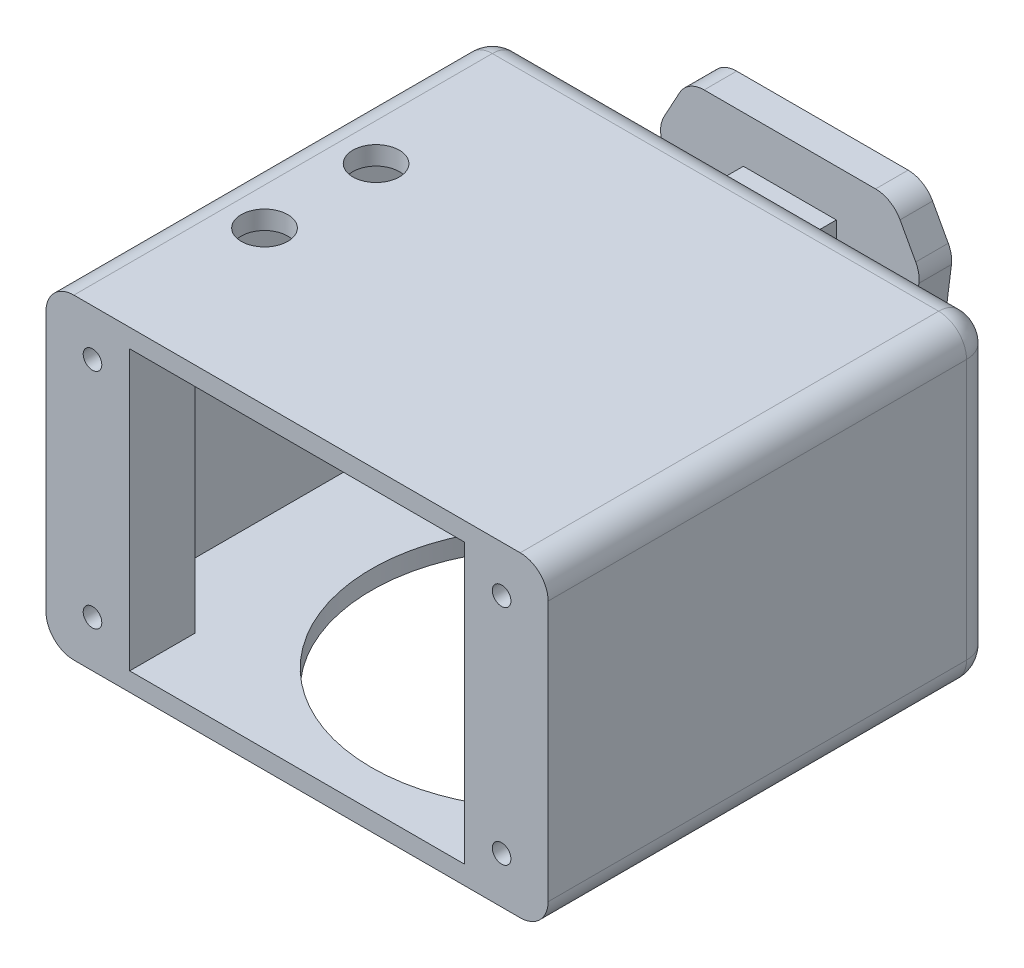
from build123d import *

# Parameters (mm, degrees)
BOSS_EXTRUDE1_DEPTH  = 3.5
SKETCH2_W            = 10
SKETCH2_H            = 3
BOSS_EXTRUDE2_DEPTH  = 5
SKETCH3_W            = 50
SKETCH3_H            = 24
BOSS_EXTRUDE3_DEPTH  = 3
SKETCH4_W            = 50
SKETCH4_H            = 3
BOSS_EXTRUDE4_DEPTH  = 35
SKETCH5_W            = 4
SKETCH5_H            = 29
CUT_EXTRUDE3_DEPTH   = 35
FILLET1_R            = 2
SKETCH6_R            = 3.175
BOSS_EXTRUDE6_DEPTH  = 35
FILLET2_R            = 3
SKETCH8_W            = 10
SKETCH8_H            = 5
BOSS_EXTRUDE7_DEPTH  = 10
SKETCH9_W            = 10
SKETCH9_H            = 5
BOSS_EXTRUDE8_DEPTH  = 10
SKETCH10_W           = 53.514300768
SKETCH10_H           = 42.489179877
CUT_EXTRUDE4_DEPTH   = 20
BOSS_EXTRUDE9_DEPTH  = 40
SKETCH13_W           = 40
SKETCH13_H           = 10
BOSS_EXTRUDE10_DEPTH = 20
SKETCH14_W           = 4
SKETCH14_H           = 20
CUT_EXTRUDE7_DEPTH   = 20
FILLET3_R            = 2
SKETCH16_W           = 40
SKETCH16_H           = 10
CUT_EXTRUDE9_DEPTH   = 4
SKETCH19_W           = 40
SKETCH19_H           = 10
CUT_EXTRUDE10_DEPTH  = 24
SKETCH20_W           = 4
SKETCH20_H           = 2
CUT_EXTRUDE11_DEPTH  = 44
FILLET4_R            = 10
SKETCH21_W           = 58
SKETCH21_H           = 24
BOSS_EXTRUDE11_DEPTH = 2
SKETCH22_W           = 54.310686521
SKETCH22_H           = 40
CUT_EXTRUDE14_DEPTH  = 57
SKETCH24_W           = 10
SKETCH24_H           = 5
CUT_EXTRUDE15_DEPTH  = 5
SKETCH25_W           = 52
SKETCH25_H           = 2
BOSS_EXTRUDE12_DEPTH = 45
SKETCH26_W           = 2
SKETCH26_H           = 45
BOSS_EXTRUDE13_DEPTH = 22
SKETCH27_R           = 2.5
CUT_EXTRUDE16_DEPTH  = 45
SKETCH29_W           = 2
SKETCH29_H           = 45
BOSS_EXTRUDE14_DEPTH = 10
SKETCH30_W           = 45
SKETCH30_H           = 2
BOSS_EXTRUDE15_DEPTH = 50
SKETCH31_R           = 18.5
CUT_EXTRUDE17_DEPTH  = 60
SKETCH32_W           = 3
SKETCH32_H           = 34
BOSS_EXTRUDE17_DEPTH = 2
SKETCH33_W           = 2
SKETCH33_H           = 34
BOSS_EXTRUDE18_DEPTH = 45
BOSS_EXTRUDE20_REACH = 76.256
SKETCH37_W           = 7
SKETCH37_H           = 7
SKETCH38_R           = 1
CUT_EXTRUDE18_DEPTH  = 16
FILLET5_R            = 3
FILLET6_R            = 3
SKETCH39_W           = 5
SKETCH39_H           = 5
CUT_EXTRUDE22_DEPTH  = 10
FILLET7_R            = 1
SKETCH40_W           = 7
SKETCH40_H           = 30
BOSS_EXTRUDE21_DEPTH = 0.2


# Some blends are built 0.0001 mm under size
with BuildPart() as part:
    # Sketch1 → Boss-Extrude1 (new body)
    with BuildSketch(Plane.XY):
        Polygon((0, 24), (3, 0), (25, 0), (28, 24), (25, 29.5), (3, 29.5), align=None)
    extrude(amount=-BOSS_EXTRUDE1_DEPTH)

    # Sketch2 → Boss-Extrude2 (add)
    with BuildSketch(Plane.XY):
        with Locations((14, 18)):
            Rectangle(SKETCH2_W, SKETCH2_H)
    extrude(amount=BOSS_EXTRUDE2_DEPTH)

    # Sketch3 → Boss-Extrude3 (add)
    with BuildSketch(Plane.XY.offset(5)):
        with Locations((14, 17.5)):
            Rectangle(SKETCH3_W, SKETCH3_H)
    extrude(amount=BOSS_EXTRUDE3_DEPTH)

    # Sketch4 → Boss-Extrude4 (add)
    with BuildSketch(Plane.XY.offset(8)):
        with Locations((14, 28)):
            Rectangle(SKETCH4_W, SKETCH4_H)
    extrude(amount=BOSS_EXTRUDE4_DEPTH)

    # Sketch5 → Cut-Extrude3 (cut)
    with BuildSketch(Plane(origin=(0, 29.5, 0), x_dir=(1, 0, 0), z_dir=(0, 1, 0))):
        with Locations((-6, -25.5)):
            Rectangle(SKETCH5_W, SKETCH5_H)
    extrude(amount=-CUT_EXTRUDE3_DEPTH, mode=Mode.SUBTRACT)

    # Fillet1
    fillet1_edges = [part.edges().sort_by_distance(p)[0] for p in [
        (-8, 28, 40),
        (-4, 28, 40),
        (-4, 28, 11),
        (-8, 28, 11),
    ]]
    fillet(fillet1_edges, radius=FILLET1_R - 0.0001)  # a hair under: the kernel refuses the full size

    # Sketch6 → Boss-Extrude6 (add)
    with BuildSketch(Plane(origin=(39, 0, 0), x_dir=(0, 0, -1), z_dir=(1, 0, 0))):
        with BuildLine():
            Line((-29.274917218, 38.5), (-43, 29.5))
            Line((-43, 29.5), (-5, 29.5))
            Line((-5, 29.5), (-21.725082782, 38.5))
            ThreePointArc((-21.725082782, 38.5), (-25.5, 40), (-29.274917218, 38.5))
        make_face()
        with Locations((-25.5, 34.5)):
            Circle(SKETCH6_R, mode=Mode.SUBTRACT)
    extrude(amount=-BOSS_EXTRUDE6_DEPTH)

    # Fillet2
    fillet2_edges = [part.edges().sort_by_distance(p)[0] for p in [
        (25, 0, -1.75),
        (3, 0, -1.75),
        (0, 24, -1.75),
        (3, 29.5, -1.75),
        (25, 29.5, -1.75),
        (28, 24, -1.75),
    ]]
    fillet(fillet2_edges, radius=FILLET2_R)

    # Sketch8 → Boss-Extrude7 (add)
    with BuildSketch(Plane(origin=(0, 19.5, 0), x_dir=(1, 0, 0), z_dir=(0, 1, 0))):
        with Locations((14, -2.5)):
            Rectangle(SKETCH8_W, SKETCH8_H)
    extrude(amount=BOSS_EXTRUDE7_DEPTH)

    # Sketch9 → Boss-Extrude8 (add)
    with BuildSketch(Plane.XZ.offset(-16.5)):
        with Locations((14, 2.5)):
            Rectangle(SKETCH9_W, SKETCH9_H)
    extrude(amount=BOSS_EXTRUDE8_DEPTH)

    # Sketch10 → Cut-Extrude4 (cut)
    with BuildSketch(Plane(origin=(0, 29.5, 0), x_dir=(1, 0, 0), z_dir=(0, 1, 0))):
        with Locations((30.757150384, -26.244589939)):
            Rectangle(SKETCH10_W, SKETCH10_H)
    extrude(amount=CUT_EXTRUDE4_DEPTH, mode=Mode.SUBTRACT)

    # Sketch11 → Boss-Extrude9 (add)
    with BuildSketch(Plane(origin=(39, 0, 0), x_dir=(0, 0, -1), z_dir=(1, 0, 0))):
        with BuildLine():
            Line((-43, 39.5), (-43, 29.5))
            Line((-43, 29.5), (-24, 29.5))
            Line((-24, 29.5), (-24, 34.5))
            ThreePointArc((-24, 34.5), (-27.535533906, 35.964466094), (-29, 39.5))
            Line((-29, 39.5), (-43, 39.5))
        make_face()
        with BuildLine():
            Line((-24, 34.5), (-24, 29.5))
            Line((-24, 29.5), (-5, 29.5))
            Line((-5, 29.5), (-5, 39.5))
            Line((-5, 39.5), (-19, 39.5))
            ThreePointArc((-19, 39.5), (-20.464466094, 35.964466094), (-24, 34.5))
        make_face()
    extrude(amount=-BOSS_EXTRUDE9_DEPTH)

    # Sketch13 → Boss-Extrude10 (add)
    with BuildSketch(Plane.XY.offset(43)):
        with Locations((19, 34.5)):
            Rectangle(SKETCH13_W, SKETCH13_H)
        Polygon((-1, 29.5), (-11, 29.5), (-11, 26.5), (39, 26.5), (39, 29.5), align=None)
    extrude(amount=BOSS_EXTRUDE10_DEPTH)

    # Sketch14 → Cut-Extrude7 (cut)
    with BuildSketch(Plane(origin=(0, 29.5, 0), x_dir=(1, 0, 0), z_dir=(0, 1, 0))):
        with Locations((-6, -48)):
            Rectangle(SKETCH14_W, SKETCH14_H)
    extrude(amount=-CUT_EXTRUDE7_DEPTH, mode=Mode.SUBTRACT)

    # Fillet3
    fillet3_edges = [part.edges().sort_by_distance(p)[0] for p in [
        (-8, 28, 58),
        (-4, 28, 58),
    ]]
    fillet(fillet3_edges, radius=FILLET3_R - 0.0001)  # a hair under: the kernel refuses the full size

    # Sketch16 → Cut-Extrude9 (cut)
    with BuildSketch(Plane(origin=(0, 0, 5), x_dir=(-1, 0, 0), z_dir=(0, 0, -1))):
        with Locations((-19, 34.5)):
            Rectangle(SKETCH16_W, SKETCH16_H)
    extrude(amount=-CUT_EXTRUDE9_DEPTH, mode=Mode.SUBTRACT)

    # Sketch19 → Cut-Extrude10 (cut)
    with BuildSketch(Plane.XY.offset(63)):
        with Locations((19, 34.5)):
            Rectangle(SKETCH19_W, SKETCH19_H)
    extrude(amount=-CUT_EXTRUDE10_DEPTH, mode=Mode.SUBTRACT)

    # Sketch20 → Cut-Extrude11 (cut)
    with BuildSketch(Plane.XY.offset(39)):
        with Locations((6, 31.5)):
            Rectangle(SKETCH20_W, SKETCH20_H)
        with Locations((32, 31.5)):
            Rectangle(SKETCH20_W, SKETCH20_H)
    extrude(amount=-CUT_EXTRUDE11_DEPTH, mode=Mode.SUBTRACT)

    # Fillet4
    # the kernel refuses this fillet: 10 mm, written as the material it takes off along each edge
    with BuildSketch(Plane(origin=(-26, 39.5, 9), x_dir=(0, 0, 1), z_dir=(1, 0, 0)), Plane(origin=(-26, 39.5, 39), x_dir=(0, -1, 0), z_dir=(1, 0, 0))) as fillet4_piece_1:
        with BuildLine():
            CenterArc((FILLET4_R, FILLET4_R), FILLET4_R, 180, 90)
            Line((0, FILLET4_R), (0, 0))
            Line((0, 0), (FILLET4_R, 0))
        make_face()
    extrude(amount=90, mode=Mode.SUBTRACT)

    # Sketch21 → Boss-Extrude11 (add)
    with BuildSketch(Plane.ZY.offset(11)):
        with Locations((34, 17.5)):
            Rectangle(SKETCH21_W, SKETCH21_H)
    extrude(amount=BOSS_EXTRUDE11_DEPTH)

    # Sketch22 → Cut-Extrude14 (cut)
    with BuildSketch(Plane.XY.offset(65)):
        with Locations((13.590652361, 21.5)):
            Rectangle(SKETCH22_W, SKETCH22_H)
    extrude(amount=-CUT_EXTRUDE14_DEPTH, mode=Mode.SUBTRACT)

    # Sketch24 → Cut-Extrude15 (cut)
    with BuildSketch(Plane(origin=(0, 29.5, 0), x_dir=(1, 0, 0), z_dir=(0, 1, 0))):
        with Locations((14, -2.5)):
            Rectangle(SKETCH24_W, SKETCH24_H)
    extrude(amount=-CUT_EXTRUDE15_DEPTH, mode=Mode.SUBTRACT)

    # Sketch25 → Boss-Extrude12 (add)
    with BuildSketch(Plane.XY.offset(8)):
        with Locations((13, 28.5)):
            Rectangle(SKETCH25_W, SKETCH25_H)
    extrude(amount=BOSS_EXTRUDE12_DEPTH)

    # Sketch26 → Boss-Extrude13 (add)
    with BuildSketch(Plane.XZ.offset(-27.5)):
        with Locations((-12, 30.5)):
            Rectangle(SKETCH26_W, SKETCH26_H)
    extrude(amount=BOSS_EXTRUDE13_DEPTH)

    # Sketch27 → Cut-Extrude16 (cut)
    with BuildSketch(Plane.XZ.offset(-27.5)):
        with Locations(Location((-6, 36.5, 0), (0, 0, 270))):
            Circle(SKETCH27_R)
        with Locations(Location((-6, 24.5, 0), (0, 0, 270))):
            Circle(SKETCH27_R)
    extrude(amount=-CUT_EXTRUDE16_DEPTH, mode=Mode.SUBTRACT)

    # Sketch29 → Boss-Extrude14 (add)
    with BuildSketch(Plane.XZ.offset(-5.5)):
        with Locations((-12, 30.5)):
            Rectangle(SKETCH29_W, SKETCH29_H)
        Polygon((-11, 8), (-13, 8), (-13, 5), (39, 5), (39, 8), align=None)
    extrude(amount=BOSS_EXTRUDE14_DEPTH)

    # Sketch30 → Boss-Extrude15 (add)
    with BuildSketch(Plane(origin=(-11, 0, 0), x_dir=(0, 0, -1), z_dir=(1, 0, 0))):
        with Locations((-30.5, -3.5)):
            Rectangle(SKETCH30_W, SKETCH30_H)
    extrude(amount=BOSS_EXTRUDE15_DEPTH)

    # Sketch31 → Cut-Extrude17 (cut)
    with BuildSketch(Plane.XZ.offset(-27.5)):
        with Locations(Location((18, 30.5, 0), (0, 0, 90))):
            Circle(SKETCH31_R)
    extrude(amount=CUT_EXTRUDE17_DEPTH, mode=Mode.SUBTRACT)

    # Sketch32 → Boss-Extrude17 (add)
    with BuildSketch(Plane(origin=(39, 0, 0), x_dir=(0, 0, -1), z_dir=(1, 0, 0))):
        with Locations((-6.5, 12.5)):
            Rectangle(SKETCH32_W, SKETCH32_H)
    extrude(amount=BOSS_EXTRUDE17_DEPTH)

    # Sketch33 → Boss-Extrude18 (add)
    with BuildSketch(Plane.XY.offset(8)):
        with Locations((40, 12.5)):
            Rectangle(SKETCH33_W, SKETCH33_H)
    extrude(amount=BOSS_EXTRUDE18_DEPTH)

    # Sketch37 → Boss-Extrude20 (add, up to next)
    with BuildSketch(Plane(origin=(0, -2.5, 0), x_dir=(1, 0, 0), z_dir=(0, 1, 0)), mode=Mode.PRIVATE) as boss_extrude20_sk1:
        with Locations((-7.5, -49.5)):
            Rectangle(SKETCH37_W, SKETCH37_H)
    boss_extrude20_tool1 = extrude(boss_extrude20_sk1.sketch, amount=BOSS_EXTRUDE20_REACH, mode=Mode.PRIVATE) - part.part
    # Sketch37 → Boss-Extrude20 (add, up to next)
    with BuildSketch(Plane(origin=(0, -2.5, 0), x_dir=(1, 0, 0), z_dir=(0, 1, 0)), mode=Mode.PRIVATE) as boss_extrude20_sk2:
        with Locations((35.5, -49.5)):
            Rectangle(SKETCH37_W, SKETCH37_H)
    boss_extrude20_tool2 = extrude(boss_extrude20_sk2.sketch, amount=BOSS_EXTRUDE20_REACH, mode=Mode.PRIVATE) - part.part
    add(boss_extrude20_tool1.solids().sort_by_distance((-7.5, -2.5, 49.5))[0])
    add(boss_extrude20_tool2.solids().sort_by_distance((35.5, -2.5, 49.5))[0])

    # Sketch38 → Cut-Extrude18 (cut)
    with BuildSketch(Plane.XY.offset(53)):
        with Locations((-8, 24.5)):
            Circle(SKETCH38_R)
        with Locations((-8, 0.5)):
            Circle(SKETCH38_R)
        with Locations((36, 24.5)):
            Circle(SKETCH38_R)
        with Locations((36, 0.5)):
            Circle(SKETCH38_R)
    extrude(amount=-CUT_EXTRUDE18_DEPTH, mode=Mode.SUBTRACT)

    # Fillet5
    fillet5_edges = [part.edges().sort_by_distance(p)[0] for p in [
        (-13, 29.5, 29),
        (-13, -4.5, 29),
        (41, 29.5, 29),
        (41, -4.5, 29),
    ]]
    fillet(fillet5_edges, radius=FILLET5_R)

    # Fillet6
    fillet6_edges = [part.edges().sort_by_distance(p)[0] for p in [
        (14, -4.5, 5),
        (14, 29.5, 5),
        (41, 12.5, 5),
        (-13, 12.5, 5),
        (40.121320344, 28.621320344, 5),
        (40.121320344, -3.621320344, 5),
        (-12.121320344, 28.621320344, 5),
        (-12.121320344, -3.621320344, 5),
    ]]
    fillet(fillet6_edges, radius=FILLET6_R)

    # Sketch39 → Cut-Extrude22 (cut)
    with BuildSketch(Plane.ZY.offset(13)):
        with Locations((12.5, 13)):
            Rectangle(SKETCH39_W, SKETCH39_H)
    extrude(amount=-CUT_EXTRUDE22_DEPTH, mode=Mode.SUBTRACT)

    # Fillet7
    fillet7_edges = [part.edges().sort_by_distance(p)[0] for p in [
        (-12, 10.5, 10),
        (-12, 15.5, 10),
        (-12, 15.5, 15),
        (-12, 10.5, 15),
    ]]
    fillet(fillet7_edges, radius=FILLET7_R)

    # Sketch40 → Boss-Extrude21 (add)
    with BuildSketch(Plane.XY.offset(46)):
        with Locations((-7.5, 12.5)):
            Rectangle(SKETCH40_W, SKETCH40_H)
        with Locations((35.5, 12.5)):
            Rectangle(SKETCH40_W, SKETCH40_H)
    extrude(amount=BOSS_EXTRUDE21_DEPTH)


solid = part.part
